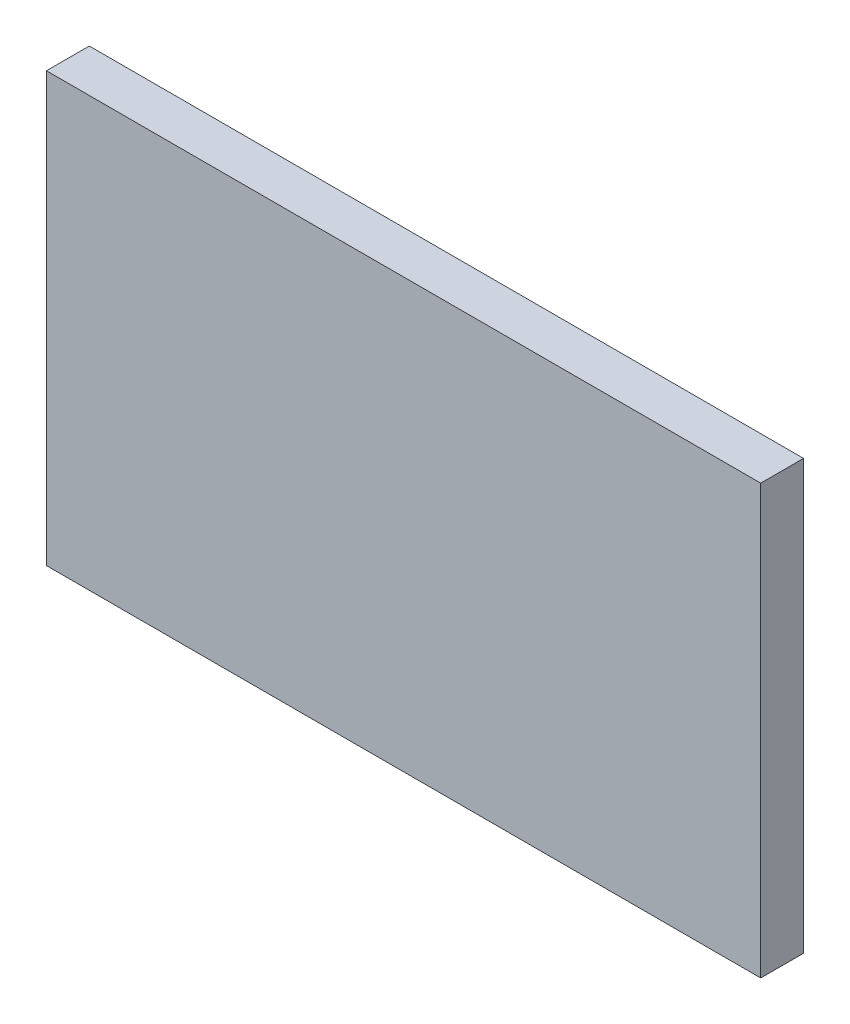
from build123d import *

# Parameters (mm, degrees)
IZIM1_W            = 250
IZIM1_H            = 150
TABAN_FLAN_1_DEPTH = 15


# Sheet-metal steps are written as plain solids
with BuildPart() as part:
    # Çizim1 → Taban-Flanş1 (new body)
    with BuildSketch(Plane.XY):
        with Locations((125, -75)):
            Rectangle(IZIM1_W, IZIM1_H)
    extrude(amount=-TABAN_FLAN_1_DEPTH)


solid = part.part
